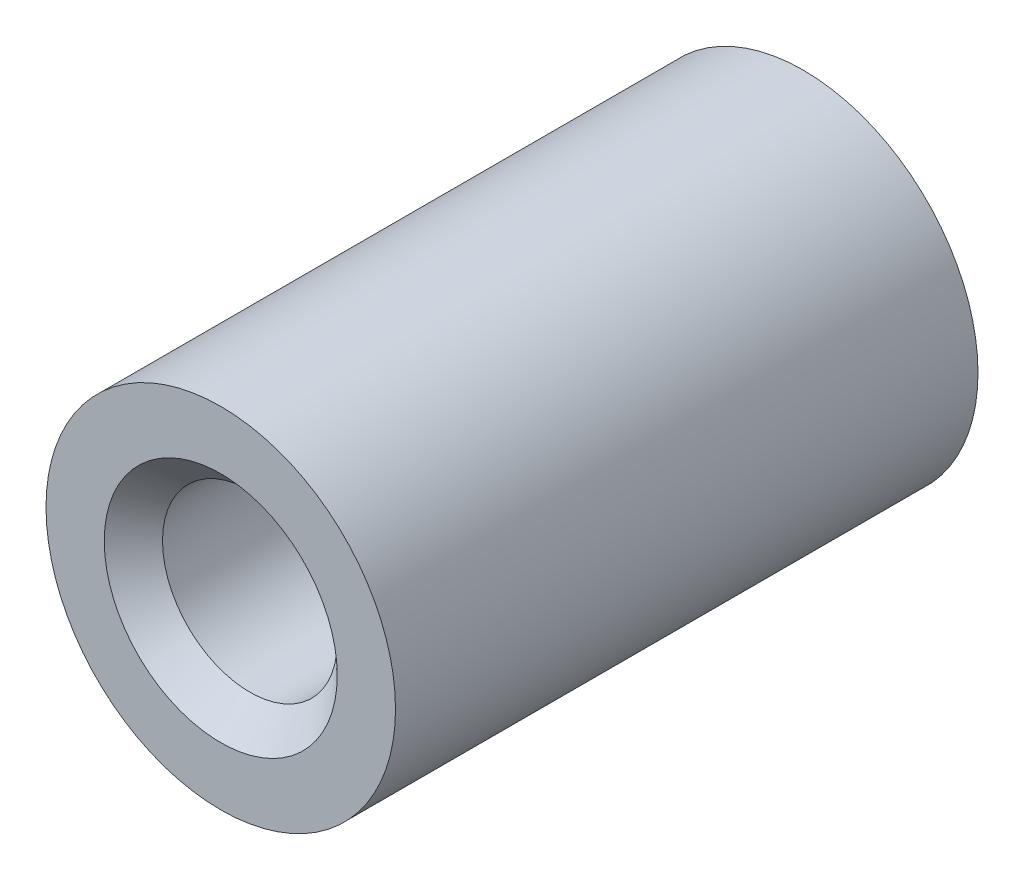
from build123d import *

# Parameters (mm, degrees)
SCHIZZO1_R                   = 3
SCHIZZO1_R_2                 = 1.5
ESTRUSIONE_ESTRUSIONE1_DEPTH = 10
SMUSSO1_SIZE                 = 0.5


with BuildPart() as part:
    # Schizzo1 → Estrusione-Estrusione1 (new body)
    with BuildSketch(Plane.XY):
        Circle(SCHIZZO1_R)
        Circle(SCHIZZO1_R_2, mode=Mode.SUBTRACT)
    extrude(amount=ESTRUSIONE_ESTRUSIONE1_DEPTH)

    # Smusso1
    smusso1_edges = [part.edges().sort_by_distance(p)[0] for p in [
        (-1.5, 0, 10),
    ]]
    chamfer(smusso1_edges, length=SMUSSO1_SIZE)


solid = part.part
